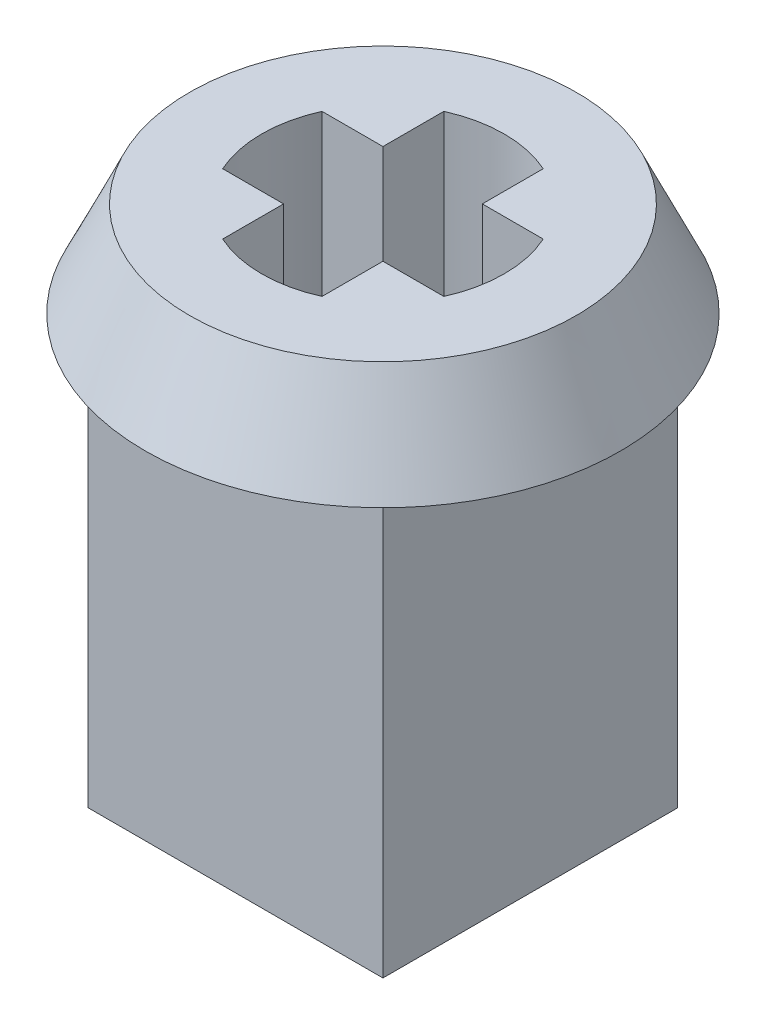
from build123d import *

# Parameters (mm, degrees)
SKETCH1_W           = 6.2
SKETCH1_H           = 6.2
BOSS_EXTRUDE1_DEPTH = 9
SKETCH2_R           = 5
BOSS_EXTRUDE2_DEPTH = 2
CUT_EXTRUDE1_REACH  = 15.077
CHAMFER1_SIZE       = 2
CHAMFER1_SIZE_2     = 0.932615316


with BuildPart() as part:
    # Sketch1 → Boss-Extrude1 (new body)
    with BuildSketch(Plane(origin=(0, 0, 0), x_dir=(1, 0, 0), z_dir=(0, 1, 0))):
        Rectangle(SKETCH1_W, SKETCH1_H)
    extrude(amount=BOSS_EXTRUDE1_DEPTH)

    # Sketch2 → Boss-Extrude2 (add)
    with BuildSketch(Plane(origin=(0, 9, 0), x_dir=(1, 0, 0), z_dir=(0, 1, 0))):
        with Locations(Location((0, 0, 0), (0, 0, 270))):
            Circle(SKETCH2_R)
    extrude(amount=BOSS_EXTRUDE2_DEPTH)

    # Sketch3 → Cut-Extrude1 (cut, up to next)
    with BuildSketch(Plane(origin=(0, 0, 0), x_dir=(-1, 0, 0), z_dir=(0, -1, 0)), mode=Mode.PRIVATE) as cut_extrude1_sk1:
        with BuildLine():
            ThreePointArc((-1.045, -2.326042777), (0, -2.55), (1.045, -2.326042777))
            Line((1.045, -2.326042777), (1.045, -1.045))
            Line((1.045, -1.045), (-1.045, -1.045))
            Line((-1.045, -1.045), (-1.045, -2.326042777))
        make_face()
    cut_extrude1_tool1 = extrude(cut_extrude1_sk1.sketch, amount=-CUT_EXTRUDE1_REACH, mode=Mode.PRIVATE) & part.part
    # Sketch3 → Cut-Extrude1 (cut, up to next)
    with BuildSketch(Plane(origin=(0, 0, 0), x_dir=(-1, 0, 0), z_dir=(0, -1, 0)), mode=Mode.PRIVATE) as cut_extrude1_sk2:
        with BuildLine():
            Line((1.045, 1.045), (1.045, -1.045))
            Line((1.045, -1.045), (2.326042777, -1.045))
            ThreePointArc((2.326042777, -1.045), (2.493382149, -0.534364538), (2.55, 0))
            ThreePointArc((2.55, 0), (2.493382149, 0.534364538), (2.326042777, 1.045))
            Line((2.326042777, 1.045), (1.045, 1.045))
        make_face()
    cut_extrude1_tool2 = extrude(cut_extrude1_sk2.sketch, amount=-CUT_EXTRUDE1_REACH, mode=Mode.PRIVATE) & part.part
    # Sketch3 → Cut-Extrude1 (cut, up to next)
    with BuildSketch(Plane(origin=(0, 0, 0), x_dir=(-1, 0, 0), z_dir=(0, -1, 0)), mode=Mode.PRIVATE) as cut_extrude1_sk3:
        Polygon((-1.045, -1.045), (1.045, -1.045), (1.045, 1.045), align=None)
    cut_extrude1_tool3 = extrude(cut_extrude1_sk3.sketch, amount=-CUT_EXTRUDE1_REACH, mode=Mode.PRIVATE) & part.part
    # Sketch3 → Cut-Extrude1 (cut, up to next)
    with BuildSketch(Plane(origin=(0, 0, 0), x_dir=(-1, 0, 0), z_dir=(0, -1, 0)), mode=Mode.PRIVATE) as cut_extrude1_sk4:
        Polygon((-1.045, -1.045), (1.045, 1.045), (-1.045, 1.045), align=None)
    cut_extrude1_tool4 = extrude(cut_extrude1_sk4.sketch, amount=-CUT_EXTRUDE1_REACH, mode=Mode.PRIVATE) & part.part
    # Sketch3 → Cut-Extrude1 (cut, up to next)
    with BuildSketch(Plane(origin=(0, 0, 0), x_dir=(-1, 0, 0), z_dir=(0, -1, 0)), mode=Mode.PRIVATE) as cut_extrude1_sk5:
        with BuildLine():
            Line((-2.326042777, -1.045), (-1.045, -1.045))
            Line((-1.045, -1.045), (-1.045, 1.045))
            Line((-1.045, 1.045), (-2.326042777, 1.045))
            ThreePointArc((-2.326042777, 1.045), (-2.55, 0), (-2.326042777, -1.045))
        make_face()
    cut_extrude1_tool5 = extrude(cut_extrude1_sk5.sketch, amount=-CUT_EXTRUDE1_REACH, mode=Mode.PRIVATE) & part.part
    # Sketch3 → Cut-Extrude1 (cut, up to next)
    with BuildSketch(Plane(origin=(0, 0, 0), x_dir=(-1, 0, 0), z_dir=(0, -1, 0)), mode=Mode.PRIVATE) as cut_extrude1_sk6:
        with BuildLine():
            Line((-1.045, 1.045), (1.045, 1.045))
            Line((1.045, 1.045), (1.045, 2.326042777))
            ThreePointArc((1.045, 2.326042777), (0, 2.55), (-1.045, 2.326042777))
            Line((-1.045, 2.326042777), (-1.045, 1.045))
        make_face()
    cut_extrude1_tool6 = extrude(cut_extrude1_sk6.sketch, amount=-CUT_EXTRUDE1_REACH, mode=Mode.PRIVATE) & part.part
    add(cut_extrude1_tool1.solids().sort_by_distance((0, 0, 1.762391))[0], mode=Mode.SUBTRACT)
    add(cut_extrude1_tool2.solids().sort_by_distance((-1.762391, 0, 0))[0], mode=Mode.SUBTRACT)
    add(cut_extrude1_tool3.solids().sort_by_distance((-0.348333, 0, 0.348333))[0], mode=Mode.SUBTRACT)
    add(cut_extrude1_tool4.solids().sort_by_distance((0.348333, 0, -0.348333))[0], mode=Mode.SUBTRACT)
    add(cut_extrude1_tool5.solids().sort_by_distance((1.762391, 0, 0))[0], mode=Mode.SUBTRACT)
    add(cut_extrude1_tool6.solids().sort_by_distance((0, 0, -1.762391))[0], mode=Mode.SUBTRACT)

    # Chamfer1
    # the kernel refuses this chamfer: 2, 0.932615316 mm, written as the material it takes off along each edge
    with BuildSketch(Plane(origin=(0, 11, 0), x_dir=(0, 0, 1), z_dir=(-1, 0, 0))) as chamfer1_piece_1:
        Polygon((5, -CHAMFER1_SIZE), (5 - CHAMFER1_SIZE_2, 0), (5, 0), align=None)
    revolve(axis=Axis((0, 11, 0), (0, 1, 0)), mode=Mode.SUBTRACT)


solid = part.part
